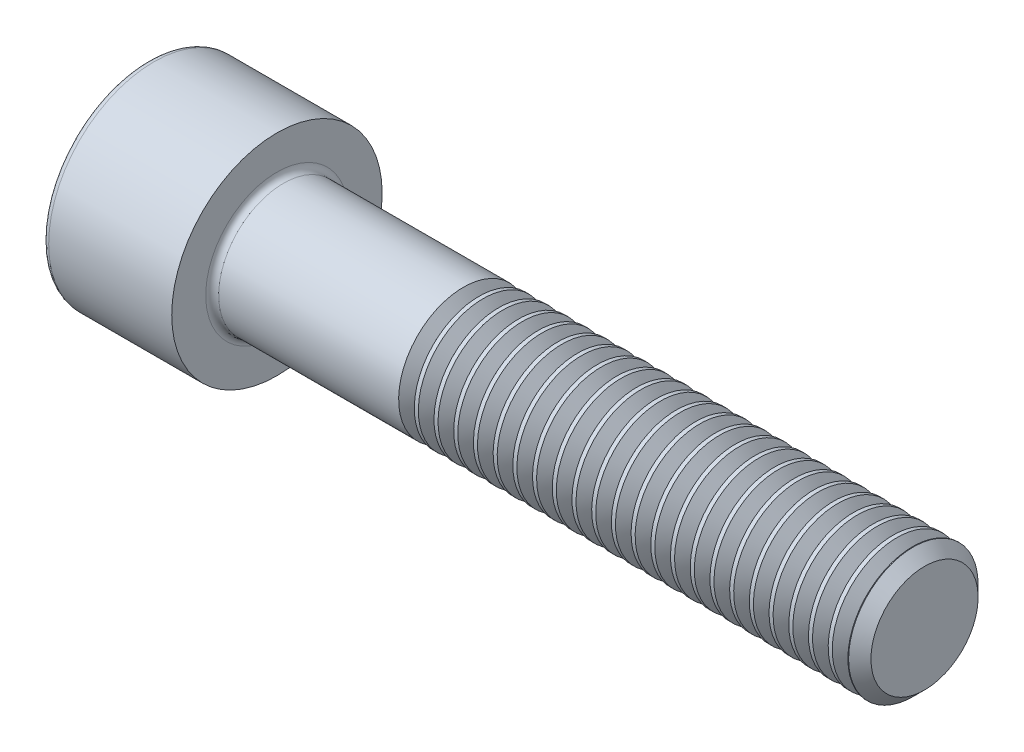
from build123d import *

# Parameters (mm, degrees)
FILLET1_R       = 0.4
FILLET2_R       = 0.4
HEX_2_DEPTH     = 4
THDSCHPAT_COUNT = 24
THDSCHPAT_PITCH = 1.217391304


with BuildPart() as part:
    # BodySke → Base-Revolve (revolve)
    with BuildSketch(Plane.XY):
        Polygon((0, 0), (0, 6.5), (8, 6.5), (8, 4), (47.3095, 4), (48, 3.3095), (48, 0), align=None)
    revolve(axis=Axis((-31.75, 0, 0), (1, 0, 0)))

    # Fillet1
    fillet1_edges = [part.edges().sort_by_distance(p)[0] for p in [
        (8, -4, 0),
    ]]
    fillet(fillet1_edges, radius=FILLET1_R)

    # Fillet2
    fillet2_edges = [part.edges().sort_by_distance(p)[0] for p in [
        (0, -6.5, 0),
    ]]
    fillet(fillet2_edges, radius=FILLET2_R)

    # Sketch2 → Hex-PreBroach (revolve, cut)
    with BuildSketch(Plane.XY):
        Polygon((0, 3.0475), (4, 3.0475), (5.759474945, 0), (0, 0), align=None)
    revolve(axis=Axis((0, 0, 0), (1, 0, 0)), mode=Mode.SUBTRACT)

    # Sketch3 → Hex 2 (cut)
    with BuildSketch(Plane(origin=(0, 0, 0), x_dir=(0, 0.500000000000001, 0.866025403784438), z_dir=(-1, 0, 0))):
        Polygon((1.759474945, 3.0475), (-1.759474945, 3.0475), (-3.518949891, 0), (-1.759474945, -3.0475), (1.759474945, -3.0475), (3.518949891, 0), align=None)
    extrude(amount=-HEX_2_DEPTH, mode=Mode.SUBTRACT)

    # ThdSchSke → ThreadSchematic (revolve, cut)
    with BuildSketch(Plane.XY):
        Polygon((20, -3.3095), (19.516506695, -4), (19.516506695, -5), (20.483493305, -5), (20.483493305, -4), align=None)
    threadschematic = revolve(axis=Axis((-3.175, 0, 0), (1, 0, 0)), mode=Mode.SUBTRACT)

    # ThdSchPat: ThreadSchematic ×24
    with Locations(*[(i * THDSCHPAT_PITCH, 0, 0) for i in range(1, THDSCHPAT_COUNT)]):
        add(threadschematic, mode=Mode.SUBTRACT)


solid = part.part
